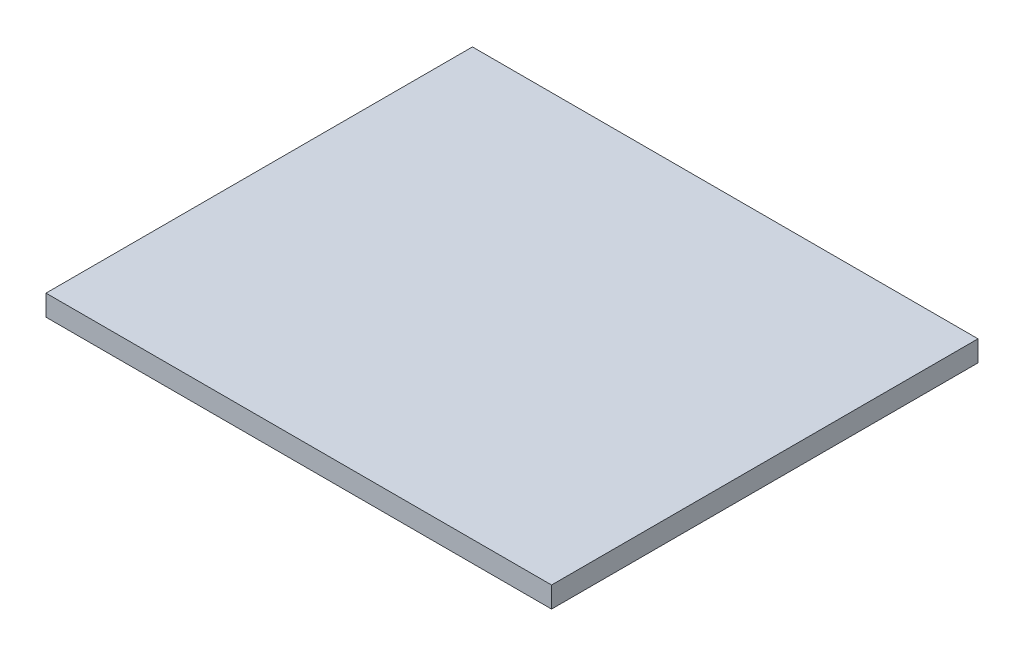
from build123d import *

# Parameters (mm, degrees)
SKETCH_1_W      = 230
SKETCH_1_H      = 194
EXTRUDE_1_DEPTH = 9.5


with BuildPart() as part:
    # 草图1 → 凸台-拉伸1 (new body)
    with BuildSketch(Plane(origin=(0, 0, 0), x_dir=(1, 0, 0), z_dir=(0, 1, 0))):
        with Locations((115, -97)):
            Rectangle(SKETCH_1_W, SKETCH_1_H)
    extrude(amount=EXTRUDE_1_DEPTH)


solid = part.part
